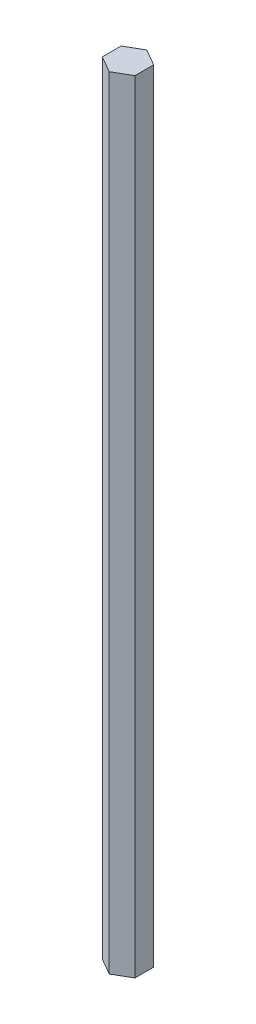
from build123d import *

# Parameters (mm, degrees)
BOSS_EXTRUDE1_DEPTH = 152.4


with BuildPart() as part:
    # Sketch1 → Boss-Extrude1 (new, symmetric)
    with BuildSketch(Plane(origin=(0, 0, 0), x_dir=(1, 0, 0), z_dir=(0, 1, 0))):
        Polygon((6.349472256, -3.667088137), (6.350527612, 3.665260206), (0.001055356, 7.332348343), (-6.349472256, 3.667088137), (-6.350527612, -3.665260206), (-0.001055356, -7.332348343), align=None)
    extrude(amount=BOSS_EXTRUDE1_DEPTH, both=True)


solid = part.part
